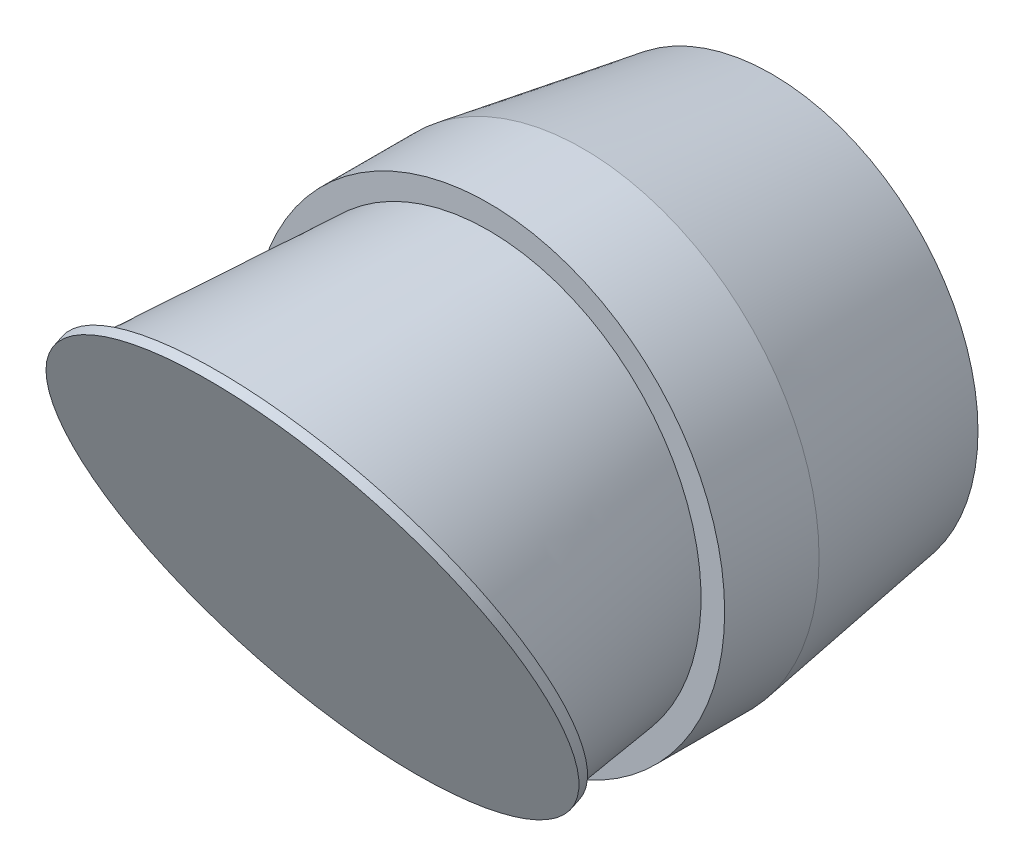
from build123d import *

# Parameters (mm, degrees)
SKETCH1_R           = 50
BOSS_EXTRUDE1_DEPTH = 20
SKETCH4_R           = 50
BOSS_EXTRUDE2_DEPTH = 40
BOSS_EXTRUDE2_TAPER = 9
SKETCH3_7_R         = 52
BOSS_EXTRUDE4_DEPTH = 2


with BuildPart() as part:
    # Sketch1 → Boss-Extrude1 (new body)
    with BuildSketch(Plane.XY):
        Circle(SKETCH1_R)
    extrude(amount=-BOSS_EXTRUDE1_DEPTH)

    # Sketch4 → Boss-Extrude2 (add)
    with BuildSketch(Plane(origin=(0, 0, -20), x_dir=(-1, 0, 0), z_dir=(0, 0, -1))):
        with Locations(Location((0, 0, 0), (0, 0, 180))):
            Circle(SKETCH4_R)
    extrude(amount=BOSS_EXTRUDE2_DEPTH, taper=BOSS_EXTRUDE2_TAPER)

    # Loft2: read off the stored shape, not the designer's step
    # Loft2: loft between two sections, ruled curve by curve
    loft2_from = [
        Edge.make_bspline([(-0.09152616, 45.31531343, 58.435490337), (1.991803683, 45.318769716, 58.437102029), (4.206873224, 45.205331996, 58.384205151), (8.88600843, 44.645276274, 58.123046879), (11.350748929, 44.198388733, 57.914659797), (16.473473932, 42.853465541, 57.287511813), (19.132143408, 41.954695988, 56.868408687), (24.523466482, 39.583734538, 55.762811206), (27.256405564, 38.110209758, 55.075695316), (32.597052055, 34.493832776, 53.389351035), (35.204002583, 32.349251741, 52.389316475), (38.814480974, 28.61367569, 50.647388755), (39.967462866, 27.282788702, 50.02678596), (42.134576019, 24.458220553, 48.709668201), (43.14861453, 22.964518438, 48.013143466), (45.000389489, 19.831572212, 46.552226648), (45.838021163, 18.192337872, 45.787839122), (47.303056553, 14.794522163, 44.203411636), (47.930358248, 13.035986558, 43.383393016), (48.947497256, 9.433887898, 41.703706825), (49.337252793, 7.590405028, 40.844076645), (49.861578346, 3.858952965, 39.104071973), (49.99610264, 1.971088931, 38.223746516), (50.00372982, -1.805187188, 36.462840042), (49.876832475, -3.693484925, 35.582312346), (49.367583678, -7.426651708, 33.841508086), (48.985277522, -9.271415445, 32.981280629), (47.982696048, -12.876864862, 31.300031954), (47.36250218, -14.637470087, 30.479048255), (45.911202122, -18.040124056, 28.892364651), (45.080197767, -19.682126696, 28.126686245), (43.241090789, -22.82119617, 26.66291411), (42.2330929, -24.318252884, 25.9648251), (40.077404144, -27.149992649, 24.644363161), (38.929806111, -28.484696346, 24.021980606), (35.334441818, -32.232227035, 22.274478346), (32.736171819, -34.385443637, 21.270416955), (27.410169514, -38.019516805, 19.575820807), (24.683201066, -39.502099682, 18.884481058), (19.301491648, -41.89093381, 17.770549409), (16.646470579, -42.798518884, 17.347335539), (11.529212738, -44.160430414, 16.712265763), (9.066293964, -44.615493042, 16.500066575), (4.389452468, -45.191070517, 16.23167039), (2.174856003, -45.311857144, 16.175346661), (-1.991803683, -45.318769716, 16.172123276), (-4.206873224, -45.205331996, 16.225020153), (-8.88600843, -44.645276274, 16.486178425), (-11.350748929, -44.198388733, 16.694565508), (-16.473473932, -42.853465541, 17.321713492), (-19.132143408, -41.954695988, 17.740816618), (-24.523466482, -39.583734538, 18.846414099), (-27.256405564, -38.110209758, 19.533529988), (-32.597052055, -34.493832776, 21.21987427), (-35.204002583, -32.349251741, 22.21990883), (-38.814480974, -28.61367569, 23.96183655), (-39.967462866, -27.282788702, 24.582439345), (-42.134576019, -24.458220553, 25.899557104), (-43.14861453, -22.964518438, 26.596081839), (-45.000389489, -19.831572212, 28.056998657), (-45.838021163, -18.192337872, 28.821386183), (-47.303056553, -14.794522163, 30.405813669), (-47.930358248, -13.035986558, 31.225832289), (-48.947497256, -9.433887898, 32.905518479), (-49.337252793, -7.590405028, 33.76514866), (-49.861578346, -3.858952965, 35.505153332), (-49.99610264, -1.971088931, 36.385478789), (-50.00372982, 1.805187188, 38.146385262), (-49.876832475, 3.693484925, 39.026912958), (-49.367583678, 7.426651708, 40.767717218), (-48.985277522, 9.271415445, 41.627944676), (-47.982696048, 12.876864862, 43.30919335), (-47.36250218, 14.637470087, 44.13017705), (-45.911202122, 18.040124056, 45.716860654), (-45.080197767, 19.682126696, 46.48253906), (-43.241090789, 22.82119617, 47.946311195), (-42.2330929, 24.318252884, 48.644400205), (-40.077404144, 27.149992649, 49.964862143), (-38.929806111, 28.484696346, 50.587244699), (-35.334441818, 32.232227035, 52.334746958), (-32.736171819, 34.385443637, 53.338808349), (-27.410169514, 38.019516805, 55.033404498), (-24.683201066, 39.502099682, 55.724744247), (-19.301491648, 41.89093381, 56.838675895), (-16.646470579, 42.798518884, 57.261889765), (-11.529212738, 44.160430414, 57.896959542), (-9.066293964, 44.615493042, 58.10915873), (-4.389452468, 45.191070517, 58.377554915), (-2.174856003, 45.311857144, 58.433878644), (-0.09152616, 45.31531343, 58.435490337)], [0, 0, 0, 0, 0.03125, 0.03125, 0.0625, 0.0625, 0.09375, 0.09375, 0.125, 0.125, 0.15625, 0.15625, 0.171875, 0.171875, 0.1875, 0.1875, 0.203125, 0.203125, 0.21875, 0.21875, 0.234375, 0.234375, 0.25, 0.25, 0.265625, 0.265625, 0.28125, 0.28125, 0.296875, 0.296875, 0.3125, 0.3125, 0.328125, 0.328125, 0.34375, 0.34375, 0.375, 0.375, 0.40625, 0.40625, 0.4375, 0.4375, 0.46875, 0.46875, 0.5, 0.5, 0.53125, 0.53125, 0.5625, 0.5625, 0.59375, 0.59375, 0.625, 0.625, 0.65625, 0.65625, 0.671875, 0.671875, 0.6875, 0.6875, 0.703125, 0.703125, 0.71875, 0.71875, 0.734375, 0.734375, 0.75, 0.75, 0.765625, 0.765625, 0.78125, 0.78125, 0.796875, 0.796875, 0.8125, 0.8125, 0.828125, 0.828125, 0.84375, 0.84375, 0.875, 0.875, 0.90625, 0.90625, 0.9375, 0.9375, 0.96875, 0.96875, 1, 1, 1, 1], 3),
    ]
    loft2_to = [
        Edge.make_bspline([(0.136420865, 44.999793214, 0), (2.011412249, 44.994109012, 0), (4.004403567, 44.871769265, 0), (8.21287139, 44.295142718, 0), (10.428953936, 43.840585304, 0), (15.032858325, 42.482621984, 0), (17.421293091, 41.578484294, 0), (22.261978921, 39.200460503, 0), (24.714480484, 37.725249561, 0), (29.503544757, 34.110714545, 0), (31.839417938, 31.969677001, 0), (35.070773805, 28.244344926, 0), (36.102019394, 26.917691058, 0), (38.03876047, 24.10333168, 0), (38.944172383, 22.615605767, 0), (40.595623515, 19.496398085, 0), (41.341568486, 17.864926477, 0), (42.643679265, 14.484388202, 0), (43.199753477, 12.735367429, 0), (44.097775949, 9.153930324, 0), (44.439650999, 7.321593977, 0), (44.893522054, 3.613861762, 0), (45.005477417, 1.738570519, 0), (44.994109012, -2.011412249, 0), (44.870785588, -3.885990223, 0), (44.394442444, -7.590902411, 0), (44.041463999, -9.421132248, 0), (43.121743345, -12.997058703, 0), (42.555074828, -14.742675783, 0), (41.232491368, -18.115257064, 0), (40.476668297, -19.742175929, 0), (38.806335385, -22.851313328, 0), (37.891919851, -24.333522272, 0), (35.93815057, -27.136087223, 0), (34.898880272, -28.456464139, 0), (31.644996659, -32.162135635, 0), (29.296185043, -34.288971141, 0), (24.485293431, -37.87440304, 0), (22.023892564, -39.33471705, 0), (17.168877462, -41.683347464, 0), (14.775004701, -42.572987164, 0), (10.162951439, -43.903011492, 0), (7.944153589, -44.344124173, 0), (3.732266966, -44.895223668, 0), (1.738570519, -45.005477417, 0), (-2.011412249, -44.994109012, 0), (-4.004403567, -44.871769265, 0), (-8.21287139, -44.295142718, 0), (-10.428953936, -43.840585304, 0), (-15.032858325, -42.482621984, 0), (-17.421293091, -41.578484294, 0), (-22.261978921, -39.200460503, 0), (-24.714480484, -37.725249561, 0), (-29.503544757, -34.110714545, 0), (-31.839417938, -31.969677001, 0), (-35.070773805, -28.244344926, 0), (-36.102019394, -26.917691058, 0), (-38.03876047, -24.10333168, 0), (-38.944172383, -22.615605767, 0), (-40.595623515, -19.496398085, 0), (-41.341568486, -17.864926477, 0), (-42.643679265, -14.484388202, 0), (-43.199753477, -12.735367429, 0), (-44.097775949, -9.153930324, 0), (-44.439650999, -7.321593977, 0), (-44.893522054, -3.613861762, 0), (-45.005477417, -1.738570519, 0), (-44.994109012, 2.011412249, 0), (-44.870785588, 3.885990223, 0), (-44.394442444, 7.590902411, 0), (-44.041463999, 9.421132248, 0), (-43.121743345, 12.997058703, 0), (-42.555074828, 14.742675783, 0), (-41.232491368, 18.115257064, 0), (-40.476668297, 19.742175929, 0), (-38.806335385, 22.851313328, 0), (-37.891919851, 24.333522272, 0), (-35.93815057, 27.136087223, 0), (-34.898880272, 28.456464139, 0), (-31.644996659, 32.162135635, 0), (-29.296185043, 34.288971141, 0), (-24.485293431, 37.87440304, 0), (-22.023892564, 39.33471705, 0), (-17.168877462, 41.683347464, 0), (-14.775004701, 42.572987164, 0), (-10.162951439, 43.903011492, 0), (-7.944153589, 44.344124173, 0), (-3.732266966, 44.895223668, 0), (-1.738570519, 45.005477417, 0), (0.136420865, 44.999793214, 0)], [0, 0, 0, 0, 0.03125, 0.03125, 0.0625, 0.0625, 0.09375, 0.09375, 0.125, 0.125, 0.15625, 0.15625, 0.171875, 0.171875, 0.1875, 0.1875, 0.203125, 0.203125, 0.21875, 0.21875, 0.234375, 0.234375, 0.25, 0.25, 0.265625, 0.265625, 0.28125, 0.28125, 0.296875, 0.296875, 0.3125, 0.3125, 0.328125, 0.328125, 0.34375, 0.34375, 0.375, 0.375, 0.40625, 0.40625, 0.4375, 0.4375, 0.46875, 0.46875, 0.5, 0.5, 0.53125, 0.53125, 0.5625, 0.5625, 0.59375, 0.59375, 0.625, 0.625, 0.65625, 0.65625, 0.671875, 0.671875, 0.6875, 0.6875, 0.703125, 0.703125, 0.71875, 0.71875, 0.734375, 0.734375, 0.75, 0.75, 0.765625, 0.765625, 0.78125, 0.78125, 0.796875, 0.796875, 0.8125, 0.8125, 0.828125, 0.828125, 0.84375, 0.84375, 0.875, 0.875, 0.90625, 0.90625, 0.9375, 0.9375, 0.96875, 0.96875, 1, 1, 1, 1], 3),
    ]
    loft2 = Solid(Shell([*[Face.make_surface_from_curves(loft2_from[k], loft2_to[k]) for k in range(1)], Face(Wire(loft2_from)), Face(Wire(loft2_to))]))
    add(loft2)

    # Sketch3<7> → Boss-Extrude4 (add)
    with BuildSketch(Plane(origin=(0, -14.288495613, 30.641777725), x_dir=(1, 0, 0), z_dir=(0, -0.4226182617407003, 0.9063077870366496))):
        with Locations(Location((0, 15.765610554, 0), (0, 0, 270))):
            Circle(SKETCH3_7_R)
    extrude(amount=-BOSS_EXTRUDE4_DEPTH)


solid = part.part
